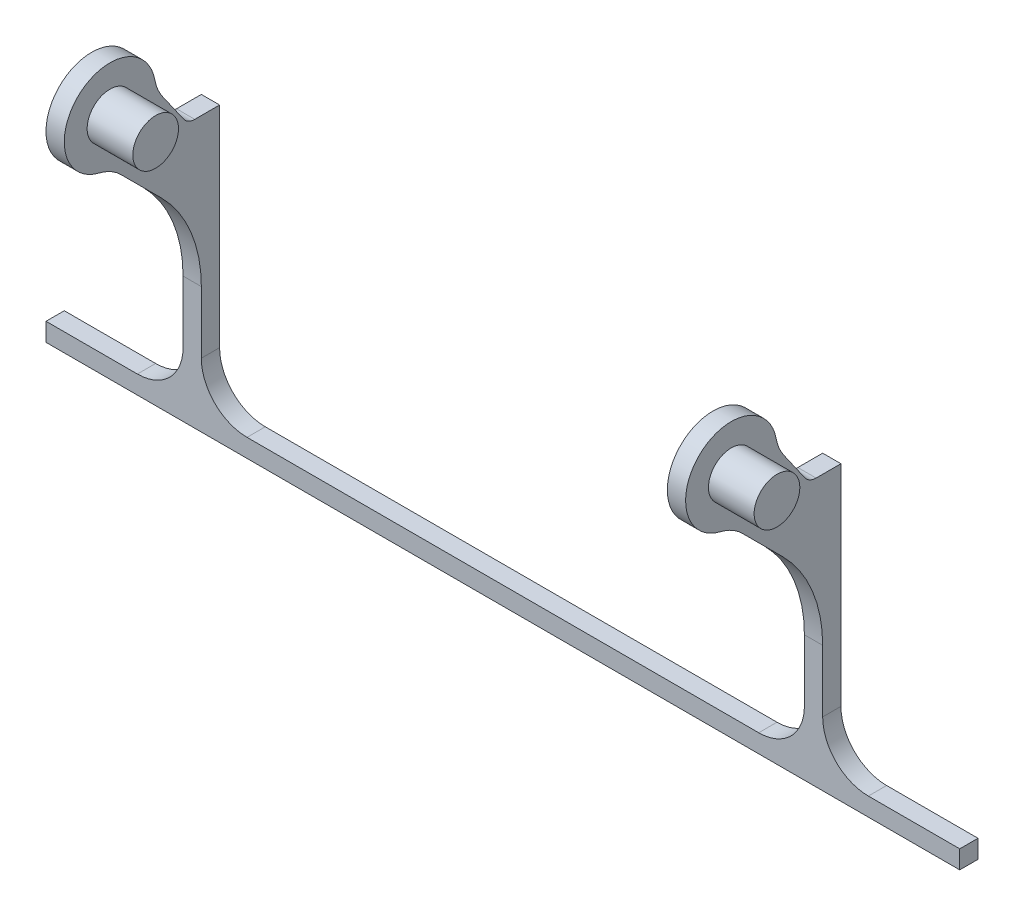
from build123d import *

# Parameters (mm, degrees)
BOSS_EXTRU_1_DEPTH = 4
BOSS_EXTRU_2_DEPTH = 4
BOSS_EXTRU_3_START = -4
BOSS_EXTRU_3_DEPTH = 4
CONG_1_R           = 30
CONG_2_R           = 30
CONG_3_R           = 10
BOSS_EXTRU_4_DEPTH = 4
BOSS_EXTRU_5_DEPTH = 4
ESQUISSE7_R        = 5
BOSS_EXTRU_6_DEPTH = 10
ESQUISSE9_R        = 5
BOSS_EXTRU_7_DEPTH = 14
CONG_4_R           = 10
CONG_5_R           = 3


with BuildPart() as part:
    # Esquisse1 → Boss.-Extru.1 (new body)
    with BuildSketch(Plane.XY):
        Polygon((-70, -110), (-66, -110), (-66, -156), (66, -156), (66, -110), (70, -110), (70, -156), (100, -156), (100, -160), (-100, -160), (-100, -156), (-70, -156), align=None)
    extrude(amount=-BOSS_EXTRU_1_DEPTH)

    # Esquisse2 → Boss.-Extru.2 (add)
    with BuildSketch(Plane(origin=(70, 0, 0), x_dir=(0, 0, -1), z_dir=(1, 0, 0))):
        with BuildLine():
            Line((0, -120), (-20, -100))
            ThreePointArc((-20, -100), (-27.071067812, -82.928932188), (-10, -90))
            Line((-10, -90), (4, -110))
            Line((4, -110), (0, -110))
            Line((0, -110), (0, -120))
        make_face()
    extrude(amount=-BOSS_EXTRU_2_DEPTH)

    # Esquisse3 → Boss.-Extru.3 (add)
    with BuildSketch(Plane.ZY.offset(70).offset(BOSS_EXTRU_3_START)):
        with BuildLine():
            Line((-4, -110), (10, -90))
            ThreePointArc((10, -90), (27.071067812, -82.928932188), (20, -100))
            Line((20, -100), (0, -120))
            Line((0, -120), (0, -110))
            Line((0, -110), (-4, -110))
        make_face()
    extrude(amount=BOSS_EXTRU_3_DEPTH)

    # Congé1
    cong_1_edges = [part.edges().sort_by_distance(p)[0] for p in [
        (68, -120, 0),
        (-68, -120, 0),
    ]]
    fillet(cong_1_edges, radius=CONG_1_R)

    # Congé2
    cong_2_edges = [part.edges().sort_by_distance(p)[0] for p in [
        (-68, -110, -4),
        (68, -110, -4),
    ]]
    fillet(cong_2_edges, radius=CONG_2_R)

    # Congé3
    cong_3_edges = [part.edges().sort_by_distance(p)[0] for p in [
        (66, -156, -2),
        (-66, -156, -2),
        (-70, -156, -2),
        (70, -156, -2),
    ]]
    fillet(cong_3_edges, radius=CONG_3_R)

    # Esquisse4 → Boss.-Extru.4 (add)
    with BuildSketch(Plane.ZY.offset(70)):
        Polygon((-4, -119.456666925), (-4, -100), (3, -100), align=None)
    extrude(amount=-BOSS_EXTRU_4_DEPTH)

    # Esquisse6 → Boss.-Extru.5 (add)
    with BuildSketch(Plane(origin=(70, 0, 0), x_dir=(0, 0, -1), z_dir=(1, 0, 0))):
        Polygon((4, -119.456666925), (4, -100), (-3, -100), align=None)
    extrude(amount=-BOSS_EXTRU_5_DEPTH)

    # Esquisse7 → Boss.-Extru.6 (add)
    with BuildSketch(Plane(origin=(70, 0, 0), x_dir=(0, 0, -1), z_dir=(1, 0, 0))):
        with Locations((-20, -90)):
            Circle(ESQUISSE7_R)
    extrude(amount=BOSS_EXTRU_6_DEPTH)

    # Esquisse9 → Boss.-Extru.7 (add)
    with BuildSketch(Plane.ZY.offset(70)):
        with Locations((20, -90)):
            Circle(ESQUISSE9_R)
    extrude(amount=-BOSS_EXTRU_7_DEPTH)

    # Congé4
    cong_4_edges = [part.edges().sort_by_distance(p)[0] for p in [
        (-68, -100, 20),
        (-68, -90, 10),
        (68, -90, 10),
        (68, -100, 20),
    ]]
    fillet(cong_4_edges, radius=CONG_4_R)

    # Congé5
    cong_5_edges = [part.edges().sort_by_distance(p)[0] for p in [
        (-68, -100, 3),
        (68, -100, 3),
    ]]
    fillet(cong_5_edges, radius=CONG_5_R)


solid = part.part
